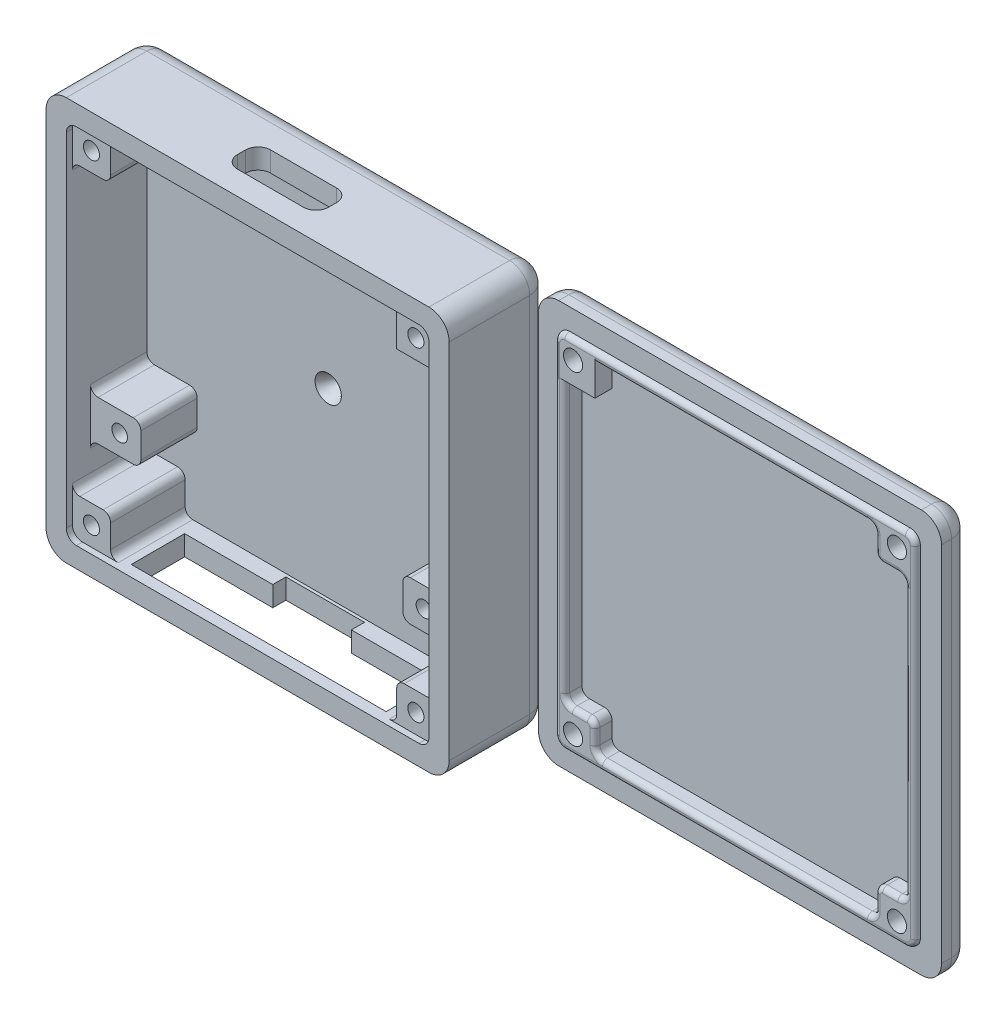
from build123d import *

# Parameters (mm, degrees)
SKETCH_1_W           = 40
SKETCH_1_H           = 40
EXTRUDE_3_DEPTH      = 10
FILLET_1_R           = 2
CUT_EXTRUDE_2_DEPTH  = 8
EXTRUDE_START        = -9.4
SKETCH_6_R           = 0.8
EXTRUDE_4_DEPTH      = 9.4
SKETCH_8_W           = 5
SKETCH_8_H           = 4
SKETCH_8_R           = 0.775
EXTRUDE_5_DEPTH      = 7.6
FILLET_2_R           = 0.75
CUT_EXTRUDE_3_REACH  = 47.826
SKETCH_9_W           = 9.05
SKETCH_9_H           = 3.3
CUT_EXTRUDE_10_REACH = 32
SKETCH_18_R          = 0.5
CHAMFER_1_SIZE       = 1.4
CHAMFER_1_SIZE2      = 0.808290377
FILLET_3_R           = 1.25
CUT_EXTRUDE_4_REACH  = 47.826
SKETCH_24_W          = 40
SKETCH_24_H          = 40
EXTRUDE_6_DEPTH      = 1.8
SKETCH_27_W          = 3.75
SKETCH_27_H          = 3.75
SKETCH_27_R          = 0.95
EXTRUDE_7_DEPTH      = 3
SKETCH_29_W          = 40
SKETCH_29_H          = 40
EXTRUDE_8_DEPTH      = 1.7
SKETCH_31_W          = 40
SKETCH_31_H          = 40
SKETCH_31_W_2        = 35.8
SKETCH_31_H_2        = 35.8
CUT_EXTRUDE_18_DEPTH = 0.5
FILLET_4_R           = 2
FILLET_5_R           = 0.75
FILLET_6_R           = 1
FILLET_7_R           = 0.5
SKETCH_28_R          = 1.65
CUT_EXTRUDE_17_DEPTH = 1.9
CUT_EXTRUDE_START    = -3.5
SKETCH_32_R          = 0.95
CUT_EXTRUDE_19_DEPTH = 3.5


with BuildPart() as part:
    # 草图1 → 凸台-拉伸3 (new body)
    with BuildSketch(Plane.XY):
        Rectangle(SKETCH_1_W, SKETCH_1_H)
    extrude(amount=EXTRUDE_3_DEPTH)

    # 圆角1
    fillet_1_edges = [part.edges().sort_by_distance(p)[0] for p in [
        (0, -20, 0),
        (-20, 0, 0),
        (0, 20, 0),
        (20, 0, 0),
        (20, -20, 5),
        (-20, -20, 5),
        (-20, 20, 5),
        (20, 20, 5),
    ]]
    fillet(fillet_1_edges, radius=FILLET_1_R)

    # 草图5 → 切除-拉伸2 (cut)
    with BuildSketch(Plane.XY.offset(10)):
        with BuildLine():
            Line((-17, 18), (17, 18))
            ThreePointArc((17, 18), (17.707106781, 17.707106781), (18, 17))
            Line((18, 17), (18, -17))
            ThreePointArc((18, -17), (17.707106781, -17.707106781), (17, -18))
            Line((17, -18), (-17, -18))
            ThreePointArc((-17, -18), (-17.707106781, -17.707106781), (-18, -17))
            Line((-18, -17), (-18, 17))
            ThreePointArc((-18, 17), (-17.707106781, 17.707106781), (-17, 18))
        make_face()
    extrude(amount=-CUT_EXTRUDE_2_DEPTH, mode=Mode.SUBTRACT)

    # 草图6 → 凸台-拉伸4 (add)
    # profile 1 of 4: a face of its own
    with BuildSketch(Plane(origin=(0, 0, 0), x_dir=(-1, 0, 0), z_dir=(0, 0, -1)).offset(EXTRUDE_START)):
        with BuildLine():
            Line((-18, -14.2), (-14.2, -14.2))
            Line((-14.2, -14.2), (-14.2, -18))
            Line((-14.2, -18), (-17, -18))
            ThreePointArc((-17, -18), (-17.707106781, -17.707106781), (-18, -17))
            Line((-18, -17), (-18, -14.2))
        make_face()
        with Locations((-16.1, -16.1)):
            Circle(SKETCH_6_R, mode=Mode.SUBTRACT)
    # profile 2 of 4: a face of its own
    with BuildSketch(Plane(origin=(0, 0, 0), x_dir=(-1, 0, 0), z_dir=(0, 0, -1)).offset(EXTRUDE_START)):
        with BuildLine():
            Line((14.2, 18), (14.2, 14.2))
            Line((14.2, 14.2), (18, 14.2))
            Line((18, 14.2), (18, 17))
            ThreePointArc((18, 17), (17.707106781, 17.707106781), (17, 18))
            Line((17, 18), (14.2, 18))
        make_face()
        with Locations((16.1, 16.1)):
            Circle(SKETCH_6_R, mode=Mode.SUBTRACT)
    # profile 3 of 4: a face of its own
    with BuildSketch(Plane(origin=(0, 0, 0), x_dir=(-1, 0, 0), z_dir=(0, 0, -1)).offset(EXTRUDE_START)):
        with BuildLine():
            Line((17, -18), (14.2, -18))
            Line((14.2, -18), (14.2, -14.2))
            Line((14.2, -14.2), (18, -14.2))
            Line((18, -14.2), (18, -17))
            ThreePointArc((18, -17), (17.707106781, -17.707106781), (17, -18))
        make_face()
        with Locations(Location((16.1, -16.1, 0), (0, 0, 180))):
            Circle(SKETCH_6_R, mode=Mode.SUBTRACT)
    # profile 4 of 4: a face of its own
    with BuildSketch(Plane(origin=(0, 0, 0), x_dir=(-1, 0, 0), z_dir=(0, 0, -1)).offset(EXTRUDE_START)):
        with BuildLine():
            Line((-14.2, 18), (-17, 18))
            ThreePointArc((-17, 18), (-17.707106781, 17.707106781), (-18, 17))
            Line((-18, 17), (-18, 14.2))
            Line((-18, 14.2), (-14.2, 14.2))
            Line((-14.2, 14.2), (-14.2, 18))
        make_face()
        with Locations(Location((-16.1, 16.1, 0), (0, 0, 180))):
            Circle(SKETCH_6_R, mode=Mode.SUBTRACT)
    extrude(amount=EXTRUDE_4_DEPTH)

    # 草图8 → 凸台-拉伸5 (add)
    # profile 1 of 2: a face of its own
    with BuildSketch(Plane(origin=(0, 0, 0), x_dir=(-1, 0, 0), z_dir=(0, 0, -1))):
        with Locations((-15.5, -8.588)):
            Rectangle(SKETCH_8_W, SKETCH_8_H)
        with Locations((-15.1, -8.588)):
            Circle(SKETCH_8_R, mode=Mode.SUBTRACT)
    # profile 2 of 2: a face of its own
    with BuildSketch(Plane(origin=(0, 0, 0), x_dir=(-1, 0, 0), z_dir=(0, 0, -1))):
        with Locations((15.5, -8.588)):
            Rectangle(SKETCH_8_W, SKETCH_8_H)
        with Locations((15.1, -8.588)):
            Circle(SKETCH_8_R, mode=Mode.SUBTRACT)
    extrude(amount=-EXTRUDE_5_DEPTH)

    # 圆角2
    fillet_2_edges = [part.edges().sort_by_distance(p)[0] for p in [
        (-14.2, 18, 5.7),
        (-18, 14.2, 5.7),
        (-14.2, 14.2, 5.7),
        (-14.2, -18, 5.7),
        (-14.2, -14.2, 5.7),
        (-18, -14.2, 5.7),
        (-13, -6.588, 4.8),
        (-18, -6.588, 4.8),
        (-18, -10.588, 4.8),
        (-13, -10.588, 4.8),
        (18, -10.588, 4.8),
        (18, -6.588, 4.8),
        (13, -6.588, 4.8),
        (13, -10.588, 4.8),
        (18, -14.2, 5.7),
        (14.2, -14.2, 5.7),
        (14.2, -18, 5.7),
    ]]
    fillet(fillet_2_edges, radius=FILLET_2_R)

    # 草图9 → 切除-拉伸3 (cut, up to next)
    with BuildSketch(Plane(origin=(0, 20, 0), x_dir=(1, 0, 0), z_dir=(0, 1, 0)), mode=Mode.PRIVATE) as cut_extrude_3_sk1:
        with Locations((-0.089506246, -6)):
            Rectangle(SKETCH_9_W, SKETCH_9_H)
    cut_extrude_3_tool1 = extrude(cut_extrude_3_sk1.sketch, amount=-CUT_EXTRUDE_3_REACH, mode=Mode.PRIVATE) & part.part
    add(cut_extrude_3_tool1.solids().sort_by_distance((-0.089506, 20, 6))[0], mode=Mode.SUBTRACT)

    # 草图18 → 切除-拉伸10 (cut, up to next)
    with BuildSketch(Plane(origin=(0, 0, 0), x_dir=(-1, 0, 0), z_dir=(0, 0, -1)), mode=Mode.PRIVATE) as cut_extrude_10_sk1:
        Circle(SKETCH_18_R)
    cut_extrude_10_tool1 = extrude(cut_extrude_10_sk1.sketch, amount=-CUT_EXTRUDE_10_REACH, mode=Mode.PRIVATE) & part.part
    add(cut_extrude_10_tool1.solids().sort_by_distance((0, 0, 0))[0], mode=Mode.SUBTRACT)

    # 倒角1
    chamfer_1_edges = [part.edges().sort_by_distance(p)[0] for p in [
        (0.5, 0, 2),
    ]]
    chamfer_1_side = [part.faces().sort_by_distance(p)[0] for p in [
        (0.5, 0, 1),
    ]]
    chamfer(chamfer_1_edges, length=CHAMFER_1_SIZE, length2=CHAMFER_1_SIZE2, reference=chamfer_1_side[0])

    # 圆角3
    fillet_3_edges = [part.edges().sort_by_distance(p)[0] for p in [
        (4.435493754, 19, 4.35),
        (4.435493754, 19, 7.65),
        (-4.614506246, 19, 7.65),
        (-4.614506246, 19, 4.35),
    ]]
    fillet(fillet_3_edges, radius=FILLET_3_R)

    # 草图10 → 切除-拉伸4 (cut, up to next)
    with BuildSketch(Plane.XZ.offset(20), mode=Mode.PRIVATE) as cut_extrude_4_sk1:
        Polygon((12.65, 3.6), (3.9, 3.6), (3.9, 2.3), (-3.9, 2.3), (-3.9, 3.6), (-12.65, 3.6), (-12.65, 8.9), (-11.18, 8.9), (-10.78, 8.9), (10.78, 8.9), (11.18, 8.9), (12.65, 8.9), align=None)
    cut_extrude_4_tool1 = extrude(cut_extrude_4_sk1.sketch, amount=-CUT_EXTRUDE_4_REACH, mode=Mode.PRIVATE) & part.part
    add(cut_extrude_4_tool1.solids().sort_by_distance((0, -20, 6.017996))[0], mode=Mode.SUBTRACT)


with BuildPart() as body_2:
    # 草图24 → 凸台-拉伸6 (new body)
    with BuildSketch(Plane(origin=(0, 0, 0), x_dir=(-1, 0, 0), z_dir=(0, 0, -1))):
        with Locations((-41.872893921, 0)):
            Rectangle(SKETCH_24_W, SKETCH_24_H)
    extrude(amount=-EXTRUDE_6_DEPTH)

    # 草图27 → 凸台-拉伸7 (add)
    # profile 1 of 4: a face of its own
    with BuildSketch(Plane.XY):
        with Locations((25.797893921, -16.075)):
            Rectangle(SKETCH_27_W, SKETCH_27_H)
        with Locations(Location((25.797893921, -16.075, 0), (0, 0, 180))):
            Circle(SKETCH_27_R, mode=Mode.SUBTRACT)
    # profile 2 of 4: a face of its own
    with BuildSketch(Plane.XY):
        with Locations((57.947893921, -16.075)):
            Rectangle(SKETCH_27_W, SKETCH_27_H)
        with Locations((57.947893921, -16.075)):
            Circle(SKETCH_27_R, mode=Mode.SUBTRACT)
    # profile 3 of 4: a face of its own
    with BuildSketch(Plane.XY):
        with Locations((25.797893921, 16.075)):
            Rectangle(SKETCH_27_W, SKETCH_27_H)
        with Locations((25.797893921, 16.075)):
            Circle(SKETCH_27_R, mode=Mode.SUBTRACT)
    # profile 4 of 4: a face of its own
    with BuildSketch(Plane.XY):
        with Locations((57.947893921, 16.075)):
            Rectangle(SKETCH_27_W, SKETCH_27_H)
        with Locations(Location((57.947893921, 16.075, 0), (0, 0, 180))):
            Circle(SKETCH_27_R, mode=Mode.SUBTRACT)
    extrude(amount=EXTRUDE_7_DEPTH)

    # 草图29 → 凸台-拉伸8 (add)
    with BuildSketch(Plane.XY.offset(1.8)):
        with Locations((41.872893921, 0)):
            Rectangle(SKETCH_29_W, SKETCH_29_H)
        Polygon((24.972893921, 13.9), (27.972893921, 13.9), (27.972893921, 16.9), (55.772893921, 16.9), (55.772893921, 13.9), (58.772893921, 13.9), (58.772893921, -13.9), (55.772893921, -13.9), (55.772893921, -16.9), (27.972893921, -16.9), (27.972893921, -13.9), (24.972893921, -13.9), align=None, mode=Mode.SUBTRACT)
    extrude(amount=EXTRUDE_8_DEPTH)

    # 草图31 → 切除-拉伸18 (cut)
    with BuildSketch(Plane.XY.offset(3.5)):
        with Locations((41.872893921, 0)):
            Rectangle(SKETCH_31_W, SKETCH_31_H)
        with Locations((41.872893921, 0)):
            Rectangle(SKETCH_31_W_2, SKETCH_31_H_2, mode=Mode.SUBTRACT)
    extrude(amount=-CUT_EXTRUDE_18_DEPTH, mode=Mode.SUBTRACT)

    # 圆角4
    fillet_4_edges = [body_2.edges().sort_by_distance(p)[0] for p in [
        (61.872893921, -20, 1.5),
        (21.872893921, -20, 1.5),
        (21.872893921, 20, 1.5),
        (61.872893921, 20, 1.5),
        (41.872893921, 20, 0),
        (21.872893921, 0, 0),
        (41.872893921, -20, 0),
        (61.872893921, 0, 0),
    ]]
    fillet(fillet_4_edges, radius=FILLET_4_R)

    # 圆角5
    fillet_5_edges = [body_2.edges().sort_by_distance(p)[0] for p in [
        (24.972893921, -13.9, 2.65),
        (27.972893921, -13.9, 2.65),
        (27.972893921, -16.9, 2.65),
        (55.772893921, -16.9, 2.65),
        (55.772893921, -13.9, 2.65),
        (58.772893921, -13.9, 2.65),
        (58.772893921, 13.9, 2.65),
        (55.772893921, 13.9, 2.65),
        (55.772893921, 16.9, 2.65),
    ]]
    fillet(fillet_5_edges, radius=FILLET_5_R)

    # 圆角6
    fillet_6_edges = [body_2.edges().sort_by_distance(p)[0] for p in [
        (59.772893921, 17.9, 3.25),
        (59.772893921, -17.9, 3.25),
        (23.972893921, -17.9, 3.25),
        (23.972893921, 17.9, 3.25),
    ]]
    fillet(fillet_6_edges, radius=FILLET_6_R)

    # 圆角7
    fillet_7_edges = [body_2.edges().sort_by_distance(p)[0] for p in [
        (24.26578714, 17.607106781, 3.5),
        (41.872893921, 17.9, 3.5),
        (59.480000703, 17.607106781, 3.5),
        (59.772893921, 0, 3.5),
        (59.480000703, -17.607106781, 3.5),
        (41.872893921, -17.9, 3.5),
        (24.26578714, -17.607106781, 3.5),
        (23.972893921, 0, 3.5),
        (28.192563836, -16.680330086, 3.5),
        (41.872893921, -16.9, 3.5),
        (55.553224007, -16.680330086, 3.5),
        (55.772893921, -15.4, 3.5),
        (55.992563836, -14.119669914, 3.5),
        (57.272893921, -13.9, 3.5),
        (58.553224007, -13.680330086, 3.5),
        (58.772893921, 0, 3.5),
        (58.553224007, 13.680330086, 3.5),
        (57.272893921, 13.9, 3.5),
        (55.992563836, 14.119669914, 3.5),
        (55.772893921, 15.4, 3.5),
        (55.553224007, 16.680330086, 3.5),
        (41.497893921, 16.9, 3.5),
        (24.972893921, 0.375, 3.5),
        (25.192563836, -13.680330086, 3.5),
        (26.472893921, -13.9, 3.5),
        (27.753224007, -14.119669914, 3.5),
        (27.972893921, -15.4, 3.5),
    ]]
    fillet(fillet_7_edges, radius=FILLET_7_R - 0.0001)  # a hair under: the kernel refuses the full size

    # 草图28 → 切除-拉伸17 (cut)
    with BuildSketch(Plane(origin=(0, 0, 0), x_dir=(-1, 0, 0), z_dir=(0, 0, -1))):
        with Locations((-25.797893921, -16.075)):
            Circle(SKETCH_28_R)
        with Locations((-57.947893921, -16.075)):
            Circle(SKETCH_28_R)
        with Locations((-57.947893921, 16.075)):
            Circle(SKETCH_28_R)
        with Locations((-25.797893921, 16.075)):
            Circle(SKETCH_28_R)
    extrude(amount=-CUT_EXTRUDE_17_DEPTH, mode=Mode.SUBTRACT)

    # 草图32 → 切除-拉伸19 (cut)
    with BuildSketch(Plane(origin=(0, 0, 0), x_dir=(-1, 0, 0), z_dir=(0, 0, -1)).offset(CUT_EXTRUDE_START)):
        with Locations((-57.947893921, 16.075)):
            Circle(SKETCH_32_R)
        with Locations((-57.947893921, -16.075)):
            Circle(SKETCH_32_R)
        with Locations((-25.797893921, -16.075)):
            Circle(SKETCH_32_R)
        with Locations(Location((-25.797893921, 16.075, 0), (0, 0, 180))):
            Circle(SKETCH_32_R)
    extrude(amount=CUT_EXTRUDE_19_DEPTH, mode=Mode.SUBTRACT)


solid = Compound([part.part, body_2.part])
